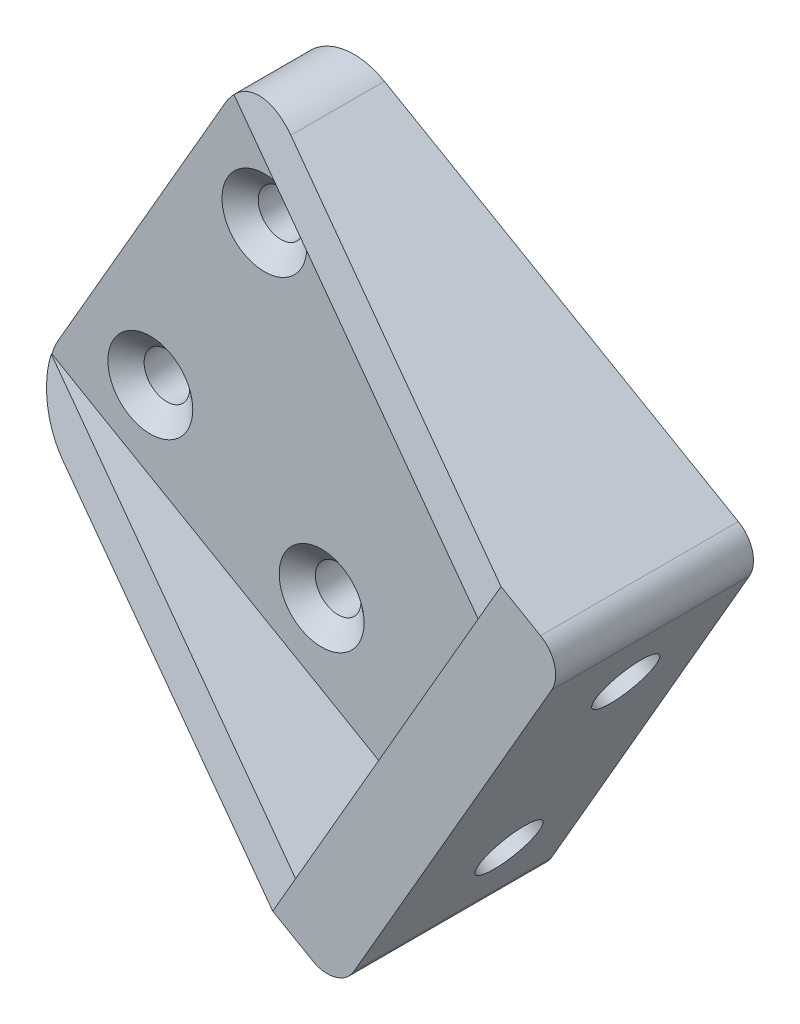
from build123d import *

# Parameters (mm, degrees)
BOSS_EXTRUDE1_DEPTH                               = 6.35
BOSS_EXTRUDE2_DEPTH                               = 10.16
BOSS_EXTRUDE3_DEPTH                               = 3.81
F_5_1_5_1_DIAMETER_HOLE1_D                        = 5.1
F_5_1_5_1_DIAMETER_HOLE1_DEPTH                    = 8.128
F_5_1_5_1_DIAMETER_HOLE1_TIP                      = 1.532194579
CSK_FOR_6_FLAT_HEAD_MACHINE_SCREW_100_D           = 3.7973
CSK_FOR_6_FLAT_HEAD_MACHINE_SCREW_100_CSINK_D     = 7.0866
CSK_FOR_6_FLAT_HEAD_MACHINE_SCREW_100_CSINK_ANGLE = 100
FILLET1_R                                         = 5.08
FILLET2_R                                         = 2.54


with BuildPart() as part:
    # Sketch2 → Boss-Extrude1 (new body)
    with BuildSketch(Plane.XY):
        Polygon((30.619607592, -39.675283942), (66.760752948, -60.541383942), (85.810752948, -27.545816058), (49.669607592, -6.679716058), align=None)
    extrude(amount=BOSS_EXTRUDE1_DEPTH)

    # Sketch3 → Boss-Extrude2 (add)
    with BuildSketch(Plane.XY.offset(6.35)):
        Polygon((80.311491634, -24.370816058), (61.261491634, -57.366383942), (66.760752948, -60.541383942), (85.810752948, -27.545816058), align=None)
    extrude(amount=BOSS_EXTRUDE2_DEPTH)

    # Sketch4 → Boss-Extrude3 (add)
    with BuildSketch(Plane(origin=(9.525, 16.497783942, 0), x_dir=(0.8660254037844388, -0.4999999999999997, 0), z_dir=(0.49999999999999983, 0.8660254037844389, 0))):
        Polygon((46.355, -6.35), (81.7372, -16.51), (81.7372, -6.35), align=None)
    boss_extrude3 = extrude(amount=-BOSS_EXTRUDE3_DEPTH)

    # Mirror1: Boss-Extrude3 across plane
    add(boss_extrude3.mirror(Plane(origin=(0, 0, 0), x_dir=(0, 0, 1), z_dir=(0.4999999999999997, 0.8660254037844389, 0))))

    # Ø5.1 (5.1) Diameter Hole1
    with Locations(Plane(origin=(76.285752948, -44.0436, 0), x_dir=(0, 0, -1), z_dir=(0.8660254037844385, -0.5000000000000004, 0))):
        with Locations((-6.937306149, 9.733087598), (-6.937306149, -9.733087598)):
            Hole(F_5_1_5_1_DIAMETER_HOLE1_D / 2, depth=F_5_1_5_1_DIAMETER_HOLE1_DEPTH)
            with Locations((0, 0, -(F_5_1_5_1_DIAMETER_HOLE1_DEPTH + F_5_1_5_1_DIAMETER_HOLE1_TIP / 2))):  # 118° drill point
                Cone(0, F_5_1_5_1_DIAMETER_HOLE1_D / 2, F_5_1_5_1_DIAMETER_HOLE1_TIP, mode=Mode.SUBTRACT)

    # CSK for #6 Flat Head Machine Screw (100)1 (through all)
    with Locations(Plane.XY.offset(6.35)):
        with Locations((40.881368906, -34.601391971), (50.406368906, -18.103608029), (64.704448323, -26.358608029), (55.179448323, -42.856391971)):
            CounterSinkHole(CSK_FOR_6_FLAT_HEAD_MACHINE_SCREW_100_D / 2, CSK_FOR_6_FLAT_HEAD_MACHINE_SCREW_100_CSINK_D / 2, counter_sink_angle=CSK_FOR_6_FLAT_HEAD_MACHINE_SCREW_100_CSINK_ANGLE)

    # Fillet1
    # the kernel refuses this fillet: 5.08 mm, written as the material it takes off along each edge
    with BuildSketch(Plane(origin=(49.669607592, -6.679716058, -12.7), x_dir=(0.8660254037844385, -0.5000000000000002, 0), z_dir=(0, 0, 1))) as fillet1_piece_1:
        with BuildLine():
            CenterArc((FILLET1_R, -FILLET1_R), FILLET1_R, 90, 90)
            Line((0, -FILLET1_R), (0, 0))
            Line((0, 0), (FILLET1_R, 0))
        make_face()
    extrude(amount=31.75, mode=Mode.SUBTRACT)
    with BuildSketch(Plane(origin=(30.619607592, -39.675283942, -12.7), x_dir=(0.8660254037844386, -0.5, 0), z_dir=(0, 0, 1))) as fillet1_piece_2:
        with BuildLine():
            CenterArc((FILLET1_R, FILLET1_R), FILLET1_R, 180, 90)
            Line((0, FILLET1_R), (0, 0))
            Line((0, 0), (FILLET1_R, 0))
        make_face()
    extrude(amount=31.75, mode=Mode.SUBTRACT)

    # Fillet2
    fillet2_edges = [part.edges().sort_by_distance(p)[0] for p in [
        (85.810752948, -27.545816058, 8.255),
        (66.760752948, -60.541383942, 8.255),
    ]]
    fillet(fillet2_edges, radius=FILLET2_R)


solid = part.part
